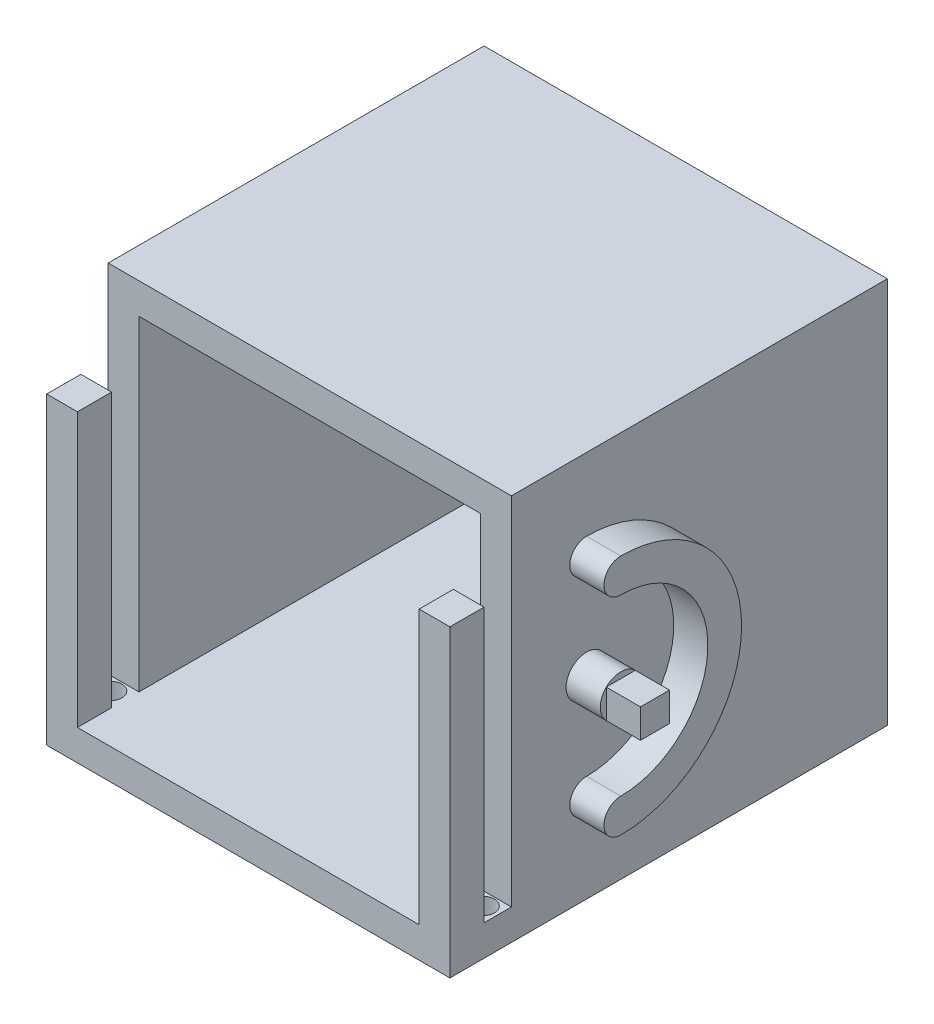
from build123d import *

# Parameters (mm, degrees)
SKETCH1_W           = 59
SKETCH1_H           = 56.6
SKETCH1_W_2         = 50
SKETCH1_H_2         = 47.6
BOSS_EXTRUDE1_DEPTH = 3
BOSS_EXTRUDE2_START = 3
SKETCH1_3_W         = 59
SKETCH1_3_H         = 56.6
SKETCH1_3_W_2       = 50
SKETCH1_3_H_2       = 47.6
BOSS_EXTRUDE2_DEPTH = 52
SKETCH2_W           = 59
SKETCH2_H           = 4.5
BOSS_EXTRUDE3_DEPTH = 4
BOSS_EXTRUDE4_DEPTH = 5
SKETCH4_R           = 1.75
CUT_EXTRUDE1_DEPTH  = 88.639374713
SKETCH5_R           = 3
BOSS_EXTRUDE5_DEPTH = 5
MIRROR1_START       = -34.5
MIRROR1_OUTLINE_R   = 3
MIRROR1_DEPTH       = 5
SKETCH6_W           = 4.242640688
SKETCH6_H           = 4.242640688
BOSS_EXTRUDE6_DEPTH = 5


# Read off the part's stored shape, not the designer's step: Mirror1
with BuildPart() as part:
    # Sketch1 → Boss-Extrude1 (new body)
    # profile 1 of 2: a face of its own
    with BuildSketch(Plane.XY):
        Rectangle(SKETCH1_W, SKETCH1_H)
        Rectangle(SKETCH1_W_2, SKETCH1_H_2, mode=Mode.SUBTRACT)
    # profile 2 of 2: a face of its own
    with BuildSketch(Plane.XY):
        Rectangle(SKETCH1_W_2, SKETCH1_H_2)
    extrude(amount=BOSS_EXTRUDE1_DEPTH)

    # Sketch1<3> → Boss-Extrude2 (add)
    with BuildSketch(Plane.XY.offset(BOSS_EXTRUDE2_START)):
        Rectangle(SKETCH1_3_W, SKETCH1_3_H)
        Rectangle(SKETCH1_3_W_2, SKETCH1_3_H_2, mode=Mode.SUBTRACT)
    extrude(amount=BOSS_EXTRUDE2_DEPTH)

    # Sketch2 → Boss-Extrude3 (add)
    with BuildSketch(Plane.XY.offset(55)):
        with Locations((0, -26.05)):
            Rectangle(SKETCH2_W, SKETCH2_H)
    extrude(amount=BOSS_EXTRUDE3_DEPTH)

    # Sketch3 → Boss-Extrude4 (add)
    with BuildSketch(Plane.XY.offset(59)):
        Polygon((-29.5, -28.3), (-29.5, 16.2), (-25, 16.2), (-25, -23.8), (25, -23.8), (25, 16.2), (29.5, 16.2), (29.5, -28.3), align=None)
    extrude(amount=BOSS_EXTRUDE4_DEPTH)

    # Sketch4 → Cut-Extrude1 (cut, through all)
    with BuildSketch(Plane(origin=(0, -23.8, 0), x_dir=(1, 0, 0), z_dir=(0, 1, 0))):
        with Locations(Location((-27.25, -57, 0), (0, 0, 270))):
            Circle(SKETCH4_R)
        with Locations(Location((27.25, -57, 0), (0, 0, 270))):
            Circle(SKETCH4_R)
    extrude(amount=-CUT_EXTRUDE1_DEPTH, mode=Mode.SUBTRACT)

    # Sketch5 → Boss-Extrude5 (add)
    with BuildSketch(Plane(origin=(29.5, 0, 0), x_dir=(0, 0, -1), z_dir=(1, 0, 0))):
        with Locations(Location((-44, 0, 0), (0, 0, 180))):
            Circle(SKETCH5_R)
        with BuildLine():
            ThreePointArc((-44, -17.67766953), (-26.32233047, 0), (-44, 17.67766953))
            ThreePointArc((-44, 17.67766953), (-46.465060373, 15.212609157), (-44, 12.747548784))
            ThreePointArc((-44, 12.747548784), (-31.252451216, 0), (-44, -12.747548784))
            ThreePointArc((-44, -12.747548784), (-46.465060373, -15.212609157), (-44, -17.67766953))
        make_face()
    extrude(amount=BOSS_EXTRUDE5_DEPTH)

    # Mirror1 outline → Mirror1 (add)
    with BuildSketch(Plane.YZ.offset(MIRROR1_START)):
        with Locations((0, 44)):
            Circle(MIRROR1_OUTLINE_R)
    extrude(amount=MIRROR1_DEPTH)

    # Sketch6 → Boss-Extrude6 (add)
    with BuildSketch(Plane(origin=(34.5, 0, 0), x_dir=(0, 0, -1), z_dir=(1, 0, 0))):
        with Locations((-44, 0)):
            Rectangle(SKETCH6_W, SKETCH6_H)
    extrude(amount=BOSS_EXTRUDE6_DEPTH)


solid = part.part
